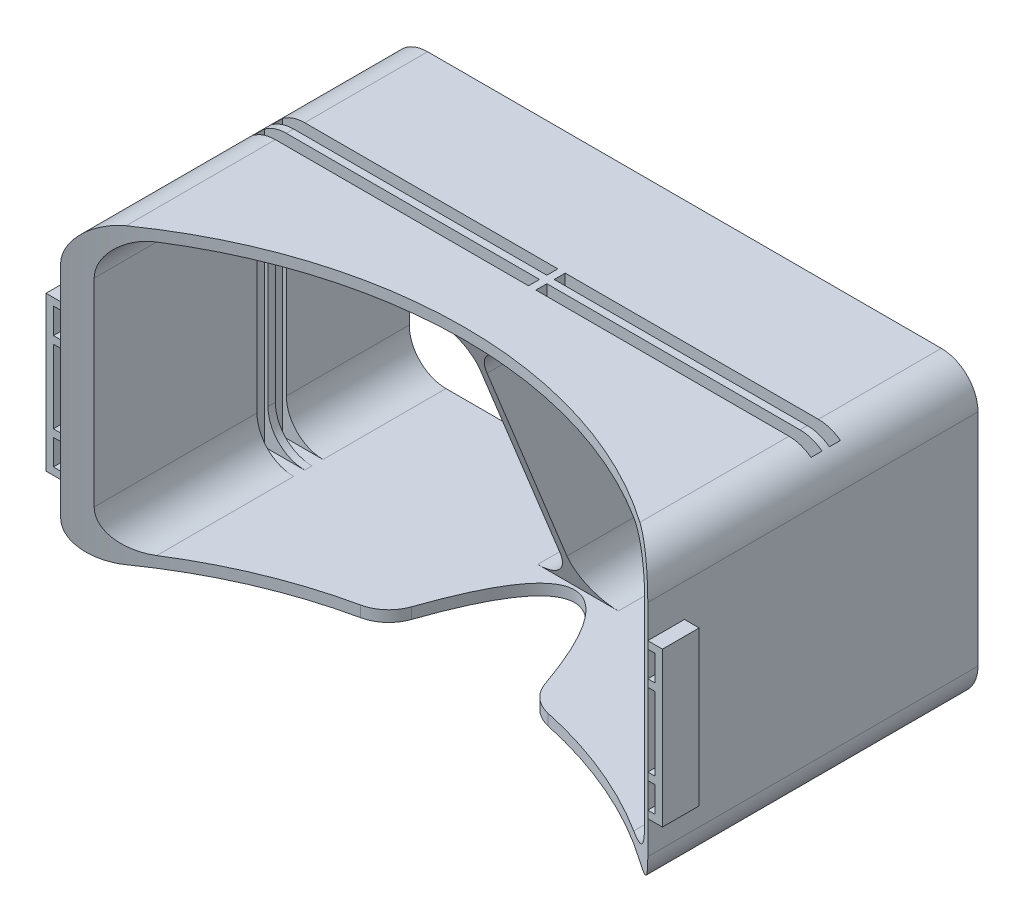
from build123d import *

# Parameters (mm, degrees)
ESBO_O1_W                  = 160
ESBO_O1_H                  = 80
RESSALTO_EXTRUS_O1_DEPTH   = 90
ESBO_O2_W                  = 150
ESBO_O2_H                  = 74
CORTE_EXTRUS_O1_DEPTH      = 90
CORTE_EXTRUS_O2_DEPTH      = 90
CORTE_EXTRUS_O3_START      = -3
CORTE_EXTRUS_O3_DEPTH      = 152.536161673
FILETE1_R                  = 10
FILETE2_R                  = 10
RESSALTO_EXTRUS_O3_DEPTH   = 2
ESBO_O14_W                 = 40
ESBO_O14_H                 = 30
RESSALTO_EXTRUS_O10_DEPTH  = 2
FILETE15_R                 = 10
FILETE16_R                 = 10
CORTE_EXTRUS_O8_DEPTH      = 20
CORTE_EXTRUS_O8_DEPTH_BACK = 20
FILETE17_R                 = 10
FILETE18_R                 = 10
FILETE19_R                 = 10
FILETE20_R                 = 10
FILETE21_R                 = 10
FILETE22_R                 = 10
ESBO_O8_W                  = 75
ESBO_O8_H                  = 3
CORTE_EXTRUS_O9_DEPTH      = 77
FILETE24_R                 = 10
FILETE25_R                 = 10
FILETE26_R                 = 10
FILETE27_R                 = 10
ESBO_O9_W                  = 10
ESBO_O9_H                  = 42
RESSALTO_EXTRUS_O11_DEPTH  = 4
ESBO_O17_W                 = 2
ESBO_O17_H                 = 7
ESBO_O17_H_2               = 20
CORTE_EXTRUS_O10_DEPTH     = 10
ESBO_O18_W                 = 10
ESBO_O18_H                 = 42
RESSALTO_EXTRUS_O12_DEPTH  = 4
ESBO_O19_W                 = 2
ESBO_O19_H                 = 7
ESBO_O19_H_2               = 20
CORTE_EXTRUS_O11_DEPTH     = 10


with BuildPart() as part:
    # Esboço1 → Ressalto-extrusão1 (new body)
    with BuildSketch(Plane.XY):
        with Locations((-6.965460526, 3.333333333)):
            Rectangle(ESBO_O1_W, ESBO_O1_H)
    extrude(amount=RESSALTO_EXTRUS_O1_DEPTH)

    # Esboço2 → Corte-extrusão1 (cut)
    with BuildSketch(Plane.XY.offset(90)):
        with Locations((-6.965460526, 3.333333333)):
            Rectangle(ESBO_O2_W, ESBO_O2_H)
    extrude(amount=-CORTE_EXTRUS_O1_DEPTH, mode=Mode.SUBTRACT)

    # Esboço3 → Corte-extrusão2 (cut)
    with BuildSketch(Plane(origin=(0, 43.333333333, 0), x_dir=(1, 0, 0), z_dir=(0, 1, 0))):
        with BuildLine():
            ThreePointArc((-6.965460526, -60), (-49.685479253, -67.746616729), (-86.965460526, -90))
            Line((-86.965460526, -90), (-6.965460526, -90))
            Line((-6.965460526, -90), (-6.965460526, -60))
        make_face()
        with BuildLine():
            Line((-6.965460526, -60), (-6.965460526, -90))
            Line((-6.965460526, -90), (73.034539474, -90))
            ThreePointArc((73.034539474, -90), (35.7545582, -67.746616729), (-6.965460526, -60))
        make_face()
    extrude(amount=-CORTE_EXTRUS_O2_DEPTH, mode=Mode.SUBTRACT)

    # Esboço5 → Corte-extrusão3 (cut, through all)
    with BuildSketch(Plane.XZ.offset(36.666666667).offset(CORTE_EXTRUS_O3_START)):
        with BuildLine():
            ThreePointArc((13.034539474, 61.655093151), (-6.965460526, 60), (-26.965460526, 61.655093151))
            add(Edge.make_bspline(
                [(-26.965460526, 61.655093151), (-6.965460526, -1.655093151), (13.034539474, 61.655093151)],
                knots=[0, 0, 0, 1, 1, 1], degree=2))
        make_face()
    extrude(amount=CORTE_EXTRUS_O3_DEPTH, mode=Mode.SUBTRACT)

    # Filete1
    filete1_edges = [part.edges().sort_by_distance(p)[0] for p in [
        (-26.965460526, -35.166666667, 61.655093151),
    ]]
    fillet(filete1_edges, radius=FILETE1_R)

    # Filete2
    filete2_edges = [part.edges().sort_by_distance(p)[0] for p in [
        (13.034539474, -35.166666667, 61.655093151),
    ]]
    fillet(filete2_edges, radius=FILETE2_R)

    # Esboço7 → Ressalto-extrusão3 (add)
    with BuildSketch(Plane.ZY.offset(5.965460526)):
        Polygon((60, 43.333333333), (0, 43.333333333), (0, -36.666666667), (28, -36.666666667), align=None)
    extrude(amount=RESSALTO_EXTRUS_O3_DEPTH)

    # Esboço14 → Ressalto-extrusão10 (add)
    with BuildSketch(Plane.ZY.offset(5.965460526)):
        with Locations((20, -18.666666667)):
            Rectangle(ESBO_O14_W, ESBO_O14_H)
    extrude(amount=RESSALTO_EXTRUS_O10_DEPTH)

    # Filete15
    # the kernel refuses this fillet: 10 mm, written as the material it adds along each edge
    with BuildSketch(Plane(origin=(-5.965460526, -33.666666667, 0), x_dir=(0, 1, 0), z_dir=(0, 0, 1))) as filete15_piece_1_section:
        with BuildLine():
            CenterArc((FILETE15_R, -FILETE15_R), FILETE15_R, 90, 90)
            Line((0, -FILETE15_R), (0, 0))
            Line((0, 0), (FILETE15_R, 0))
        make_face()
    filete15_piece_1 = extrude(amount=55.079137733, mode=Mode.PRIVATE)
    filete15_piece_1 = split(filete15_piece_1, bisect_by=Plane(origin=(-3.65687296, -31.473045743, 40), z_dir=(0, 0, -1)), keep=Keep.TOP, mode=Mode.PRIVATE)
    add(filete15_piece_1)

    # Filete16
    # the kernel refuses this fillet: 10 mm, written as the material it adds along each edge
    with BuildSketch(Plane(origin=(-7.965460526, -33.666666667, 55.079137733), x_dir=(-1, 0, 0), z_dir=(0, 0, -1))) as filete16_piece_1_section:
        with BuildLine():
            CenterArc((FILETE16_R, FILETE16_R), FILETE16_R, 180, 90)
            Line((0, FILETE16_R), (0, 0))
            Line((0, 0), (FILETE16_R, 0))
        make_face()
    filete16_piece_1 = extrude(amount=55.079137733, mode=Mode.PRIVATE)
    filete16_piece_1 = split(filete16_piece_1, bisect_by=Plane(origin=(-9.937156606, -31.292891496, 40), z_dir=(0, 0, -1)), keep=Keep.TOP, mode=Mode.PRIVATE)
    add(filete16_piece_1)

    # Esboço16 → Corte-extrusão8 (cut, two sides: drawn at the far end of the back side and taken through both)
    with BuildSketch(Plane.ZY.offset(5.965460526).offset(-CORTE_EXTRUS_O8_DEPTH_BACK)):
        Polygon((29, -33.666666667), (58.8, 40.333333333), (60, -33.666666667), align=None)
    extrude(amount=CORTE_EXTRUS_O8_DEPTH + CORTE_EXTRUS_O8_DEPTH_BACK, mode=Mode.SUBTRACT)

    # Filete17
    filete17_edges = [part.edges().sort_by_distance(p)[0] for p in [
        (-81.965460526, 40.333333333, 42.932973789),
    ]]
    fillet(filete17_edges, radius=FILETE17_R)

    # Filete18
    # the kernel refuses this fillet: 10 mm, written as the material it adds along each edge
    with BuildSketch(Plane(origin=(-5.965460526, 40.333333333, 83.8), x_dir=(1, 0, 0), z_dir=(0, 0, -1))) as filete18_piece_1_section:
        with BuildLine():
            CenterArc((FILETE18_R, FILETE18_R), FILETE18_R, 180, 90)
            Line((0, FILETE18_R), (0, 0))
            Line((0, 0), (FILETE18_R, 0))
        make_face()
    filete18_piece_1 = extrude(amount=83.8, mode=Mode.PRIVATE)
    filete18_piece_1 = split(filete18_piece_1, bisect_by=Plane(origin=(-3.682408993, 28.070036468, 53.861537208), z_dir=(0, 0.37355092292184666, -0.927609674369687)), keep=Keep.TOP, mode=Mode.PRIVATE)
    add(filete18_piece_1)

    # Filete19
    filete19_edges = [part.edges().sort_by_distance(p)[0] for p in [
        (68.034539474, 40.333333333, 42.932973789),
    ]]
    fillet(filete19_edges, radius=FILETE19_R)

    # Filete20
    # the kernel refuses this fillet: 10 mm, written as the material it adds along each edge
    with BuildSketch(Plane(origin=(-7.965460526, 40.333333333, 83.8), x_dir=(-1, 0, 0), z_dir=(0, 0, -1))) as filete20_piece_1_section:
        with BuildLine():
            CenterArc((FILETE20_R, -FILETE20_R), FILETE20_R, 90, 90)
            Line((0, -FILETE20_R), (0, 0))
            Line((0, 0), (FILETE20_R, 0))
        make_face()
    filete20_piece_1 = extrude(amount=83.8, mode=Mode.PRIVATE)
    filete20_piece_1 = split(filete20_piece_1, bisect_by=Plane(origin=(-10.248512059, 28.070036468, 53.861537208), z_dir=(0, 0.37355092292187014, -0.9276096743696776)), keep=Keep.TOP, mode=Mode.PRIVATE)
    add(filete20_piece_1)

    # Filete21
    filete21_edges = [part.edges().sort_by_distance(p)[0] for p in [
        (68.034539474, -33.666666667, 42.932973789),
    ]]
    fillet(filete21_edges, radius=FILETE21_R)

    # Filete22
    filete22_edges = [part.edges().sort_by_distance(p)[0] for p in [
        (-81.965460526, -33.666666667, 42.932973789),
    ]]
    fillet(filete22_edges, radius=FILETE22_R)

    # Esboço8 → Corte-extrusão9 (cut)
    with BuildSketch(Plane(origin=(0, 43.333333333, 0), x_dir=(1, 0, 0), z_dir=(0, 1, 0))):
        with Locations((-45.465460526, -35)):
            Rectangle(ESBO_O8_W, ESBO_O8_H)
        with Locations((31.534539474, -35)):
            Rectangle(ESBO_O8_W, ESBO_O8_H)
        with Locations((-45.465460526, -40)):
            Rectangle(ESBO_O8_W, ESBO_O8_H)
        with Locations((31.534539474, -40)):
            Rectangle(ESBO_O8_W, ESBO_O8_H)
    extrude(amount=-CORTE_EXTRUS_O9_DEPTH, mode=Mode.SUBTRACT)

    # Filete24
    filete24_edges = [part.edges().sort_by_distance(p)[0] for p in [
        (73.034539474, -36.666666667, 45),
    ]]
    fillet(filete24_edges, radius=FILETE24_R)

    # Filete25
    filete25_edges = [part.edges().sort_by_distance(p)[0] for p in [
        (-86.965460526, -36.666666667, 45),
    ]]
    fillet(filete25_edges, radius=FILETE25_R)

    # Filete26
    # the kernel refuses this fillet: 10 mm, written as the material it takes off along each edge
    with BuildSketch(Plane(origin=(-86.965460526, 43.333333333, -25), x_dir=(0, -1, 0), z_dir=(0, 0, 1))) as filete26_piece_1:
        with BuildLine():
            CenterArc((FILETE26_R, FILETE26_R), FILETE26_R, 180, 90)
            Line((0, FILETE26_R), (0, 0))
            Line((0, 0), (FILETE26_R, 0))
        make_face()
    extrude(amount=140, mode=Mode.SUBTRACT)

    # Filete27
    # the kernel refuses this fillet: 10 mm, written as the material it takes off along each edge
    with BuildSketch(Plane(origin=(73.034539474, 43.333333333, -25), x_dir=(-1, 0, 0), z_dir=(0, 0, 1))) as filete27_piece_1:
        with BuildLine():
            CenterArc((FILETE27_R, FILETE27_R), FILETE27_R, 180, 90)
            Line((0, FILETE27_R), (0, 0))
            Line((0, 0), (FILETE27_R, 0))
        make_face()
    extrude(amount=140, mode=Mode.SUBTRACT)

    # Esboço9 → Ressalto-extrusão11 (add)
    with BuildSketch(Plane.ZY.offset(86.965460526)):
        with Locations((85, 3.333333333)):
            Rectangle(ESBO_O9_W, ESBO_O9_H)
    extrude(amount=RESSALTO_EXTRUS_O11_DEPTH)

    # Esboço17 → Corte-extrusão10 (cut)
    with BuildSketch(Plane.XY.offset(90)):
        with Locations((-87.965460526, 18.833333333)):
            Rectangle(ESBO_O17_W, ESBO_O17_H)
        with Locations((-87.965460526, 3.333333333)):
            Rectangle(ESBO_O17_W, ESBO_O17_H_2)
        with Locations((-87.965460526, -12.166666667)):
            Rectangle(ESBO_O17_W, ESBO_O17_H)
    extrude(amount=-CORTE_EXTRUS_O10_DEPTH, mode=Mode.SUBTRACT)

    # Esboço18 → Ressalto-extrusão12 (add)
    with BuildSketch(Plane(origin=(73.034539474, 0, 0), x_dir=(0, 0, -1), z_dir=(1, 0, 0))):
        with Locations((-85, 3.333333333)):
            Rectangle(ESBO_O18_W, ESBO_O18_H)
    extrude(amount=RESSALTO_EXTRUS_O12_DEPTH)

    # Esboço19 → Corte-extrusão11 (cut)
    with BuildSketch(Plane.XY.offset(90)):
        with Locations((74.034539474, 18.833333333)):
            Rectangle(ESBO_O19_W, ESBO_O19_H)
        with Locations((74.034539474, 3.333333333)):
            Rectangle(ESBO_O19_W, ESBO_O19_H_2)
        with Locations((74.034539474, -12.166666667)):
            Rectangle(ESBO_O19_W, ESBO_O19_H)
    extrude(amount=-CORTE_EXTRUS_O11_DEPTH, mode=Mode.SUBTRACT)


solid = part.part
